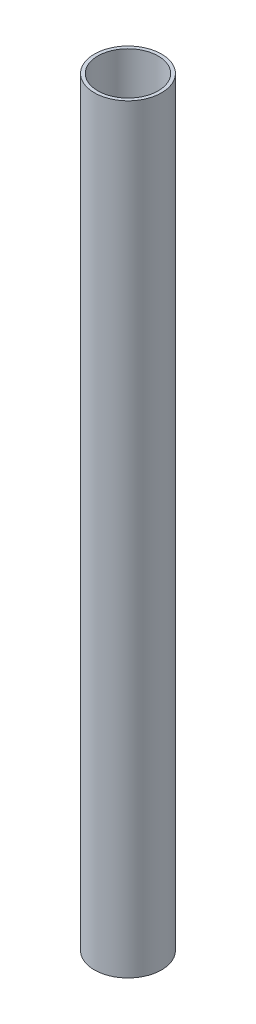
from build123d import *

# Parameters (mm, degrees)
SKETCH1_R           = 10
SKETCH1_R_2         = 9
BOSS_EXTRUDE1_DEPTH = 226.2


with BuildPart() as part:
    # Sketch1 → Boss-Extrude1 (new body)
    with BuildSketch(Plane(origin=(0, 0, 0), x_dir=(1, 0, 0), z_dir=(0, 1, 0))):
        Circle(SKETCH1_R)
        Circle(SKETCH1_R_2, mode=Mode.SUBTRACT)
    extrude(amount=BOSS_EXTRUDE1_DEPTH)


solid = part.part
